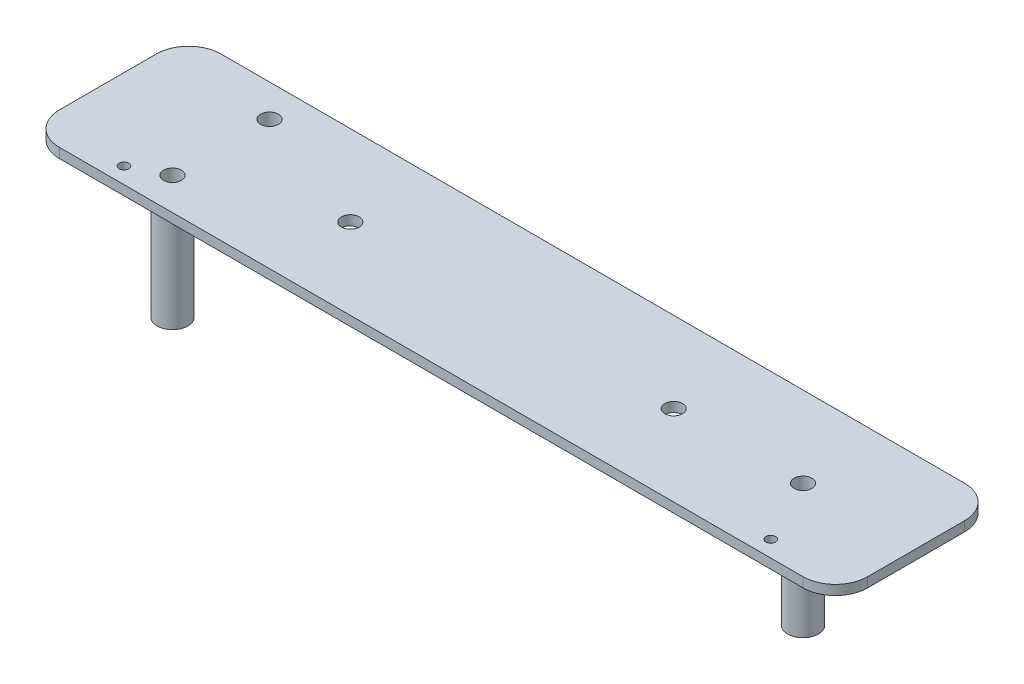
from build123d import *
from build123d.topology import SkipClean

# Parameters (mm, degrees)
SKETCH1_R           = 2.75
SKETCH1_R_2         = 1.5
BOSS_EXTRUDE1_DEPTH = 3
BOSS_EXTRUDE2_START = 35
SKETCH2_R           = 4.75
SKETCH2_R_2         = 2.75
BOSS_EXTRUDE2_DEPTH = 35


with BuildPart() as part:
    # Sketch1 → Boss-Extrude1 (new body)
    with BuildSketch(Plane(origin=(0, 0, 0), x_dir=(1, 0, 0), z_dir=(0, 1, 0))):
        with BuildLine():
            Line((-115, 25), (115, 25))
            ThreePointArc((115, 25), (122.071067812, 22.071067812), (125, 15))
            Line((125, 15), (125, -15))
            ThreePointArc((125, -15), (122.071067812, -22.071067812), (115, -25))
            Line((115, -25), (-115, -25))
            ThreePointArc((-115, -25), (-122.071067812, -22.071067812), (-125, -15))
            Line((-125, -15), (-125, 15))
            ThreePointArc((-125, 15), (-122.071067812, 22.071067812), (-115, 25))
        make_face()
        with Locations((90, 0)):
            Circle(SKETCH1_R, mode=Mode.SUBTRACT)
        with Locations((-90, 15)):
            Circle(SKETCH1_R, mode=Mode.SUBTRACT)
        with Locations((-50, 0)):
            Circle(SKETCH1_R, mode=Mode.SUBTRACT)
        with Locations((50, 0)):
            Circle(SKETCH1_R, mode=Mode.SUBTRACT)
        with Locations((-90, -15)):
            Circle(SKETCH1_R, mode=Mode.SUBTRACT)
        with Locations((-100, -20)):
            Circle(SKETCH1_R_2, mode=Mode.SUBTRACT)
        with Locations((100, -20)):
            Circle(SKETCH1_R_2, mode=Mode.SUBTRACT)
    extrude(amount=BOSS_EXTRUDE1_DEPTH)

    # Sketch2 → Boss-Extrude2 (add)
    # profile 1 of 3: a face of its own
    with SkipClean():  # the faces are left unmerged after this step: merging them gives an invalid solid
        with BuildSketch(Plane(origin=(0, 0, 0), x_dir=(-1, 0, 0), z_dir=(0, -1, 0)).offset(BOSS_EXTRUDE2_START)):
            with Locations((90, -15)):
                Circle(SKETCH2_R)
            with Locations((90, -15)):
                Circle(SKETCH2_R_2, mode=Mode.SUBTRACT)
        # profile 2 of 3: a face of its own
        with BuildSketch(Plane(origin=(0, 0, 0), x_dir=(-1, 0, 0), z_dir=(0, -1, 0)).offset(BOSS_EXTRUDE2_START)):
            with Locations((90, 15)):
                Circle(SKETCH2_R)
            with Locations((90, 15)):
                Circle(SKETCH2_R_2, mode=Mode.SUBTRACT)
        # profile 3 of 3: a face of its own
        with BuildSketch(Plane(origin=(0, 0, 0), x_dir=(-1, 0, 0), z_dir=(0, -1, 0)).offset(BOSS_EXTRUDE2_START)):
            with Locations((-90, 0)):
                Circle(SKETCH2_R)
            with Locations((-90, 0)):
                Circle(SKETCH2_R_2, mode=Mode.SUBTRACT)
        extrude(amount=-BOSS_EXTRUDE2_DEPTH)


solid = part.part
